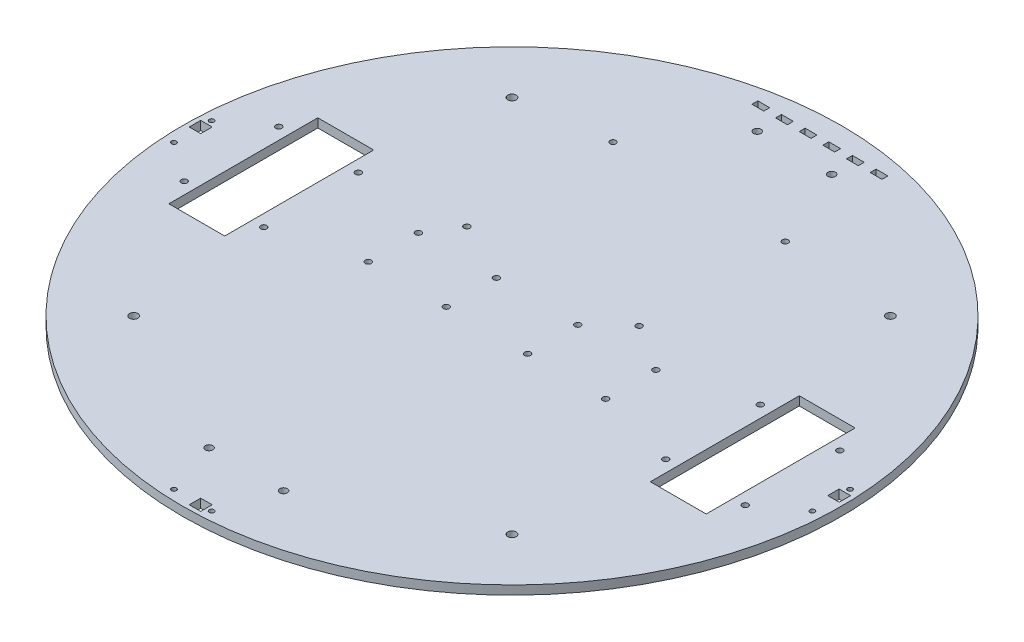
from build123d import *

# Parameters (mm, degrees)
SKETCH1_R           = 177
SKETCH1_R_2         = 1.6
SKETCH1_R_3         = 2.2479
SKETCH1_R_4         = 2.000000064
SKETCH1_R_5         = 1.3
SKETCH1_R_6         = 1.29999994
SKETCH1_W           = 6.15
SKETCH1_H           = 6.15
SKETCH1_W_2         = 30
SKETCH1_H_2         = 80
SKETCH1_W_3         = 6.35
SKETCH1_H_3         = 3.175
BOSS_EXTRUDE1_DEPTH = 4.7625


with BuildPart() as part:
    # Sketch1 → Boss-Extrude1 (new body)
    with BuildSketch(Plane(origin=(0, 0, 0), x_dir=(1, 0, 0), z_dir=(0, 1, 0))):
        Circle(SKETCH1_R)
        with Locations((-150.65, 25.4)):
            Circle(SKETCH1_R_2, mode=Mode.SUBTRACT)
        with Locations((-150.65, -25.4)):
            Circle(SKETCH1_R_2, mode=Mode.SUBTRACT)
        with Locations((150.65, 25.4)):
            Circle(SKETCH1_R_2, mode=Mode.SUBTRACT)
        with Locations((150.65, -25.4)):
            Circle(SKETCH1_R_2, mode=Mode.SUBTRACT)
        with Locations((-107.95, 25.4)):
            Circle(SKETCH1_R_2, mode=Mode.SUBTRACT)
        with Locations((-107.95, -25.4)):
            Circle(SKETCH1_R_2, mode=Mode.SUBTRACT)
        with Locations((107.95, 25.4)):
            Circle(SKETCH1_R_2, mode=Mode.SUBTRACT)
        with Locations((107.95, -25.4)):
            Circle(SKETCH1_R_2, mode=Mode.SUBTRACT)
        with Locations((-53.7, 107.95)):
            Circle(SKETCH1_R_2, mode=Mode.SUBTRACT)
        with Locations((38.8, 107.95)):
            Circle(SKETCH1_R_2, mode=Mode.SUBTRACT)
        with Locations((-53.7, 29.45)):
            Circle(SKETCH1_R_2, mode=Mode.SUBTRACT)
        with Locations((38.8, 29.45)):
            Circle(SKETCH1_R_2, mode=Mode.SUBTRACT)
        with Locations((-101.6, -101.6)):
            Circle(SKETCH1_R_3, mode=Mode.SUBTRACT)
        with Locations((101.6, -101.6)):
            Circle(SKETCH1_R_3, mode=Mode.SUBTRACT)
        with Locations((-101.6, 101.6)):
            Circle(SKETCH1_R_3, mode=Mode.SUBTRACT)
        with Locations((101.6, 101.6)):
            Circle(SKETCH1_R_3, mode=Mode.SUBTRACT)
        with Locations((-20, -142.687006289)):
            Circle(SKETCH1_R_4, mode=Mode.SUBTRACT)
        with Locations((20, -142.687006289)):
            Circle(SKETCH1_R_4, mode=Mode.SUBTRACT)
        with Locations((-20, 151.719279026)):
            Circle(SKETCH1_R_4, mode=Mode.SUBTRACT)
        with Locations((20, 151.719279026)):
            Circle(SKETCH1_R_4, mode=Mode.SUBTRACT)
        with Locations((-10.125, -171.45)):
            Circle(SKETCH1_R_5, mode=Mode.SUBTRACT)
        with Locations((10.125, -171.45)):
            Circle(SKETCH1_R_6, mode=Mode.SUBTRACT)
        with Locations((171.45, -10.125)):
            Circle(SKETCH1_R_5, mode=Mode.SUBTRACT)
        with Locations((171.45, 10.125)):
            Circle(SKETCH1_R_5, mode=Mode.SUBTRACT)
        with Locations((-171.45, -10.125)):
            Circle(SKETCH1_R_5, mode=Mode.SUBTRACT)
        with Locations((-171.45, 10.125)):
            Circle(SKETCH1_R_5, mode=Mode.SUBTRACT)
        with Locations((-63.76, 13.473999986)):
            Circle(SKETCH1_R_2, mode=Mode.SUBTRACT)
        with Locations((-63.76, -13.450000014)):
            Circle(SKETCH1_R_2, mode=Mode.SUBTRACT)
        with Locations((-21.85, 13.473999986)):
            Circle(SKETCH1_R_2, mode=Mode.SUBTRACT)
        with Locations((-21.85, -13.450000014)):
            Circle(SKETCH1_R_2, mode=Mode.SUBTRACT)
        with Locations((63.76, -13.450000014)):
            Circle(SKETCH1_R_2, mode=Mode.SUBTRACT)
        with Locations((21.85, -13.450000014)):
            Circle(SKETCH1_R_2, mode=Mode.SUBTRACT)
        with Locations((21.85, 13.473999986)):
            Circle(SKETCH1_R_2, mode=Mode.SUBTRACT)
        with Locations((63.76, 13.473999986)):
            Circle(SKETCH1_R_2, mode=Mode.SUBTRACT)
        with Locations((171.45, 4.26)):
            Rectangle(SKETCH1_W, SKETCH1_H, mode=Mode.SUBTRACT)
        with Locations((-129.3, 0)):
            Rectangle(SKETCH1_W_2, SKETCH1_H_2, mode=Mode.SUBTRACT)
        with Locations((129.3, 0)):
            Rectangle(SKETCH1_W_2, SKETCH1_H_2, mode=Mode.SUBTRACT)
        with Locations((4.26, -171.45)):
            Rectangle(SKETCH1_W, SKETCH1_H, mode=Mode.SUBTRACT)
        with Locations((-171.45, 4.26)):
            Rectangle(SKETCH1_W, SKETCH1_H, mode=Mode.SUBTRACT)
        with Locations((-18.119952608, 164.452014647)):
            Rectangle(SKETCH1_W_3, SKETCH1_H_3, mode=Mode.SUBTRACT)
        with Locations((-30.819952608, 164.452014647)):
            Rectangle(SKETCH1_W_3, SKETCH1_H_3, mode=Mode.SUBTRACT)
        with Locations((-5.419952608, 164.452014647)):
            Rectangle(SKETCH1_W_3, SKETCH1_H_3, mode=Mode.SUBTRACT)
        with Locations((7.280047392, 164.452014647)):
            Rectangle(SKETCH1_W_3, SKETCH1_H_3, mode=Mode.SUBTRACT)
        with Locations((19.980047392, 164.452014647)):
            Rectangle(SKETCH1_W_3, SKETCH1_H_3, mode=Mode.SUBTRACT)
        with Locations((32.680047392, 164.452014647)):
            Rectangle(SKETCH1_W_3, SKETCH1_H_3, mode=Mode.SUBTRACT)
    extrude(amount=BOSS_EXTRUDE1_DEPTH)


solid = part.part
